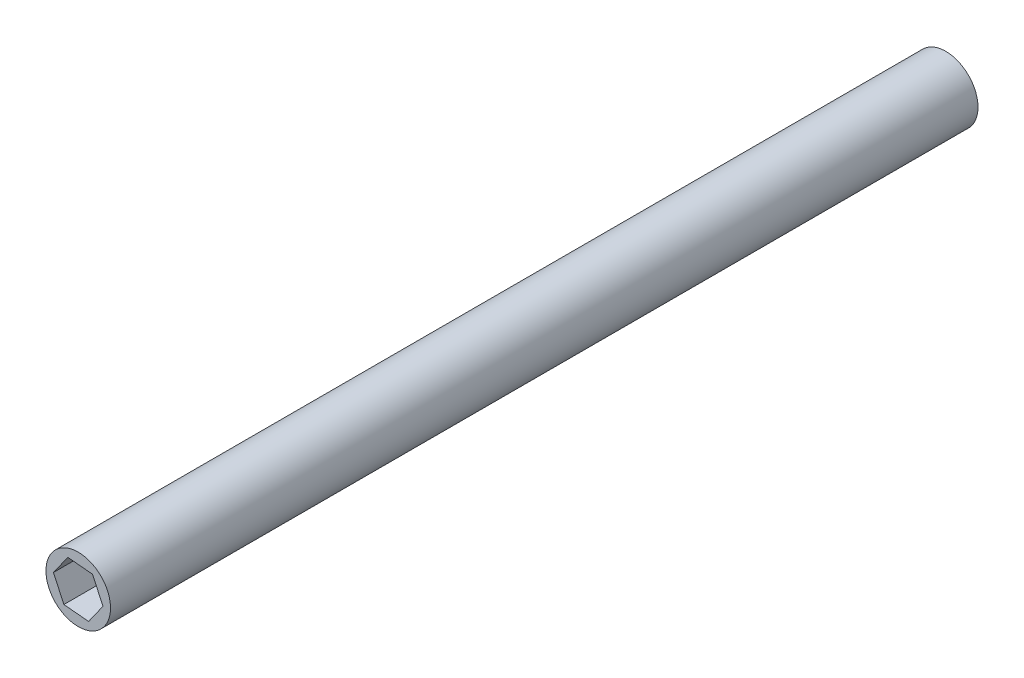
from build123d import *

# Parameters (mm, degrees)
IZIM1_R                         = 12
Y_KSEKLIK_EKSTR_ZYON1_DEPTH     = 300
Y_KSEKLIK_EKSTR_ZYON2_START     = -22.5
Y_KSEKLIK_EKSTR_ZYON2_OUTLINE_R = 12
Y_KSEKLIK_EKSTR_ZYON2_DEPTH     = 22.5


# Read off the part's stored shape, not the designer's step: Yükseklik-Ekstrüzyon2
with BuildPart() as part:
    # Çizim1 → Yükseklik-Ekstrüzyon1 (new body)
    with BuildSketch(Plane.XY):
        Circle(IZIM1_R)
        Polygon((9.198634805, -0.847614925), (5.33337346, 7.542443958), (-3.865261344, 8.390058884), (-9.198634805, 0.847614925), (-5.33337346, -7.542443958), (3.865261344, -8.390058884), align=None, mode=Mode.SUBTRACT)
    extrude(amount=Y_KSEKLIK_EKSTR_ZYON1_DEPTH)

    # Yükseklik-Ekstrüzyon2 outline → Yükseklik-Ekstrüzyon2 (add)
    with BuildSketch(Plane.XY.offset(Y_KSEKLIK_EKSTR_ZYON2_START)):
        Circle(Y_KSEKLIK_EKSTR_ZYON2_OUTLINE_R)
        with BuildLine():
            ThreePointArc((7.692208361, 1.457590549), (7.755311042, 1.36747058), (7.726836763, 1.261203123))
            Line((7.726836763, 1.261203123), (7.386733823, 0.855884222))
            ThreePointArc((7.386733823, 0.855884222), (7.407856389, 0.648103455), (7.423135474, 0.439811449))
            Line((7.423135474, 0.439811449), (7.828454374, 0.099708509))
            ThreePointArc((7.828454374, 0.099708509), (7.874949216, 0), (7.828454374, -0.099708509))
            Line((7.828454374, -0.099708509), (7.423135474, -0.439811449))
            ThreePointArc((7.423135474, -0.439811449), (7.407856389, -0.648103455), (7.386733823, -0.855884222))
            Line((7.386733823, -0.855884222), (7.726836763, -1.261203123))
            ThreePointArc((7.726836763, -1.261203123), (7.755311042, -1.36747058), (7.692208361, -1.457590549))
            Line((7.692208361, -1.457590549), (7.23398891, -1.722143673))
            ThreePointArc((7.23398891, -1.722143673), (7.182772421, -1.92461807), (7.125890003, -2.125574285))
            Line((7.125890003, -2.125574285), (7.390443126, -2.583793737))
            ThreePointArc((7.390443126, -2.583793737), (7.400031667, -2.69339126), (7.322238489, -2.771184438))
            Line((7.322238489, -2.771184438), (6.825041253, -2.952149432))
            ThreePointArc((6.825041253, -2.952149432), (6.739443548, -3.142654138), (6.648529621, -3.330679849))
            Line((6.648529621, -3.330679849), (6.829494615, -3.827877085))
            ThreePointArc((6.829494615, -3.827877085), (6.819906075, -3.937474608), (6.729786106, -4.000577289))
            Line((6.729786106, -4.000577289), (6.208718171, -4.092455625))
            ThreePointArc((6.208718171, -4.092455625), (6.091340093, -4.265202251), (5.96915703, -4.434584391))
            Line((5.96915703, -4.434584391), (6.061035366, -4.955652325))
            ThreePointArc((6.061035366, -4.955652325), (6.032561087, -5.061919783), (5.932852577, -5.108414624))
            Line((5.932852577, -5.108414624), (5.40374633, -5.108414624))
            ThreePointArc((5.40374633, -5.108414624), (5.258154352, -5.258154352), (5.108414624, -5.40374633))
            Line((5.108414624, -5.40374633), (5.108414624, -5.932852577))
            ThreePointArc((5.108414624, -5.932852577), (5.061919783, -6.032561087), (4.955652325, -6.061035366))
            Line((4.955652325, -6.061035366), (4.434584391, -5.96915703))
            ThreePointArc((4.434584391, -5.96915703), (4.265202251, -6.091340093), (4.092455625, -6.208718171))
            Line((4.092455625, -6.208718171), (4.000577289, -6.729786106))
            ThreePointArc((4.000577289, -6.729786106), (3.937474608, -6.819906075), (3.827877085, -6.829494615))
            Line((3.827877085, -6.829494615), (3.330679849, -6.648529621))
            ThreePointArc((3.330679849, -6.648529621), (3.142654138, -6.739443548), (2.952149432, -6.825041253))
            Line((2.952149432, -6.825041253), (2.771184438, -7.322238489))
            ThreePointArc((2.771184438, -7.322238489), (2.69339126, -7.400031667), (2.583793737, -7.390443126))
            Line((2.583793737, -7.390443126), (2.125574285, -7.125890003))
            ThreePointArc((2.125574285, -7.125890003), (1.92461807, -7.182772421), (1.722143673, -7.23398891))
            Line((1.722143673, -7.23398891), (1.457590549, -7.692208361))
            ThreePointArc((1.457590549, -7.692208361), (1.36747058, -7.755311042), (1.261203123, -7.726836763))
            Line((1.261203123, -7.726836763), (0.855884222, -7.386733823))
            ThreePointArc((0.855884222, -7.386733823), (0.648103455, -7.407856389), (0.439811449, -7.423135474))
            Line((0.439811449, -7.423135474), (0.099708509, -7.828454374))
            ThreePointArc((0.099708509, -7.828454374), (0, -7.874949216), (-0.099708509, -7.828454374))
            Line((-0.099708509, -7.828454374), (-0.439811449, -7.423135474))
            ThreePointArc((-0.439811449, -7.423135474), (-0.648103455, -7.407856389), (-0.855884222, -7.386733823))
            Line((-0.855884222, -7.386733823), (-1.261203123, -7.726836763))
            ThreePointArc((-1.261203123, -7.726836763), (-1.36747058, -7.755311042), (-1.457590549, -7.692208361))
            Line((-1.457590549, -7.692208361), (-1.722143673, -7.23398891))
            ThreePointArc((-1.722143673, -7.23398891), (-1.92461807, -7.182772421), (-2.125574285, -7.125890003))
            Line((-2.125574285, -7.125890003), (-2.583793737, -7.390443126))
            ThreePointArc((-2.583793737, -7.390443126), (-2.69339126, -7.400031667), (-2.771184438, -7.322238489))
            Line((-2.771184438, -7.322238489), (-2.952149432, -6.825041253))
            ThreePointArc((-2.952149432, -6.825041253), (-3.142654138, -6.739443548), (-3.330679849, -6.648529621))
            Line((-3.330679849, -6.648529621), (-3.827877085, -6.829494615))
            ThreePointArc((-3.827877085, -6.829494615), (-3.937474608, -6.819906075), (-4.000577289, -6.729786106))
            Line((-4.000577289, -6.729786106), (-4.092455625, -6.208718171))
            ThreePointArc((-4.092455625, -6.208718171), (-4.265202251, -6.091340093), (-4.434584391, -5.96915703))
            Line((-4.434584391, -5.96915703), (-4.955652325, -6.061035366))
            ThreePointArc((-4.955652325, -6.061035366), (-5.061919783, -6.032561087), (-5.108414624, -5.932852577))
            Line((-5.108414624, -5.932852577), (-5.108414624, -5.40374633))
            ThreePointArc((-5.108414624, -5.40374633), (-5.258154352, -5.258154352), (-5.40374633, -5.108414624))
            Line((-5.40374633, -5.108414624), (-5.932852577, -5.108414624))
            ThreePointArc((-5.932852577, -5.108414624), (-6.032561087, -5.061919783), (-6.061035366, -4.955652325))
            Line((-6.061035366, -4.955652325), (-5.96915703, -4.434584391))
            ThreePointArc((-5.96915703, -4.434584391), (-6.091340093, -4.265202251), (-6.208718171, -4.092455625))
            Line((-6.208718171, -4.092455625), (-6.729786106, -4.000577289))
            ThreePointArc((-6.729786106, -4.000577289), (-6.819906075, -3.937474608), (-6.829494615, -3.827877085))
            Line((-6.829494615, -3.827877085), (-6.648529621, -3.330679849))
            ThreePointArc((-6.648529621, -3.330679849), (-6.739443548, -3.142654138), (-6.825041253, -2.952149432))
            Line((-6.825041253, -2.952149432), (-7.322238489, -2.771184438))
            ThreePointArc((-7.322238489, -2.771184438), (-7.400031667, -2.69339126), (-7.390443126, -2.583793737))
            Line((-7.390443126, -2.583793737), (-7.125890003, -2.125574285))
            ThreePointArc((-7.125890003, -2.125574285), (-7.182772421, -1.92461807), (-7.23398891, -1.722143673))
            Line((-7.23398891, -1.722143673), (-7.692208361, -1.457590549))
            ThreePointArc((-7.692208361, -1.457590549), (-7.755311042, -1.36747058), (-7.726836763, -1.261203123))
            Line((-7.726836763, -1.261203123), (-7.386733823, -0.855884222))
            ThreePointArc((-7.386733823, -0.855884222), (-7.407856389, -0.648103455), (-7.423135474, -0.439811449))
            Line((-7.423135474, -0.439811449), (-7.828454374, -0.099708509))
            ThreePointArc((-7.828454374, -0.099708509), (-7.874949216, 0), (-7.828454374, 0.099708509))
            Line((-7.828454374, 0.099708509), (-7.423135474, 0.439811449))
            ThreePointArc((-7.423135474, 0.439811449), (-7.407856389, 0.648103455), (-7.386733823, 0.855884222))
            Line((-7.386733823, 0.855884222), (-7.726836763, 1.261203123))
            ThreePointArc((-7.726836763, 1.261203123), (-7.755311042, 1.36747058), (-7.692208361, 1.457590549))
            Line((-7.692208361, 1.457590549), (-7.23398891, 1.722143673))
            ThreePointArc((-7.23398891, 1.722143673), (-7.182772421, 1.92461807), (-7.125890003, 2.125574285))
            Line((-7.125890003, 2.125574285), (-7.390443126, 2.583793737))
            ThreePointArc((-7.390443126, 2.583793737), (-7.400031667, 2.69339126), (-7.322238489, 2.771184438))
            Line((-7.322238489, 2.771184438), (-6.825041253, 2.952149432))
            ThreePointArc((-6.825041253, 2.952149432), (-6.739443548, 3.142654138), (-6.648529621, 3.330679849))
            Line((-6.648529621, 3.330679849), (-6.829494615, 3.827877085))
            ThreePointArc((-6.829494615, 3.827877085), (-6.819906075, 3.937474608), (-6.729786106, 4.000577289))
            Line((-6.729786106, 4.000577289), (-6.208718171, 4.092455625))
            ThreePointArc((-6.208718171, 4.092455625), (-6.091340093, 4.265202251), (-5.96915703, 4.434584391))
            Line((-5.96915703, 4.434584391), (-6.061035366, 4.955652325))
            ThreePointArc((-6.061035366, 4.955652325), (-6.032561087, 5.061919783), (-5.932852577, 5.108414624))
            Line((-5.932852577, 5.108414624), (-5.40374633, 5.108414624))
            ThreePointArc((-5.40374633, 5.108414624), (-5.258154352, 5.258154352), (-5.108414624, 5.40374633))
            Line((-5.108414624, 5.40374633), (-5.108414624, 5.932852577))
            ThreePointArc((-5.108414624, 5.932852577), (-5.061919783, 6.032561087), (-4.955652325, 6.061035366))
            Line((-4.955652325, 6.061035366), (-4.434584391, 5.96915703))
            ThreePointArc((-4.434584391, 5.96915703), (-4.265202251, 6.091340093), (-4.092455625, 6.208718171))
            Line((-4.092455625, 6.208718171), (-4.000577289, 6.729786106))
            ThreePointArc((-4.000577289, 6.729786106), (-3.937474608, 6.819906075), (-3.827877085, 6.829494615))
            Line((-3.827877085, 6.829494615), (-3.330679849, 6.648529621))
            ThreePointArc((-3.330679849, 6.648529621), (-3.142654138, 6.739443548), (-2.952149432, 6.825041253))
            Line((-2.952149432, 6.825041253), (-2.771184438, 7.322238489))
            ThreePointArc((-2.771184438, 7.322238489), (-2.69339126, 7.400031667), (-2.583793737, 7.390443126))
            Line((-2.583793737, 7.390443126), (-2.125574285, 7.125890003))
            ThreePointArc((-2.125574285, 7.125890003), (-1.92461807, 7.182772421), (-1.722143673, 7.23398891))
            Line((-1.722143673, 7.23398891), (-1.457590549, 7.692208361))
            ThreePointArc((-1.457590549, 7.692208361), (-1.36747058, 7.755311042), (-1.261203123, 7.726836763))
            Line((-1.261203123, 7.726836763), (-0.855884222, 7.386733823))
            Line((-0.855884222, 7.386733823), (0.855884222, 7.386733823))
            Line((0.855884222, 7.386733823), (1.261203123, 7.726836763))
            ThreePointArc((1.261203123, 7.726836763), (1.36747058, 7.755311042), (1.457590549, 7.692208361))
            Line((1.457590549, 7.692208361), (1.722143673, 7.23398891))
            ThreePointArc((1.722143673, 7.23398891), (1.92461807, 7.182772421), (2.125574285, 7.125890003))
            Line((2.125574285, 7.125890003), (2.583793737, 7.390443126))
            ThreePointArc((2.583793737, 7.390443126), (2.69339126, 7.400031667), (2.771184438, 7.322238489))
            Line((2.771184438, 7.322238489), (2.952149432, 6.825041253))
            ThreePointArc((2.952149432, 6.825041253), (3.142654138, 6.739443548), (3.330679849, 6.648529621))
            Line((3.330679849, 6.648529621), (3.827877085, 6.829494615))
            ThreePointArc((3.827877085, 6.829494615), (3.937474608, 6.819906075), (4.000577289, 6.729786106))
            Line((4.000577289, 6.729786106), (4.092455625, 6.208718171))
            ThreePointArc((4.092455625, 6.208718171), (4.265202251, 6.091340093), (4.434584391, 5.96915703))
            Line((4.434584391, 5.96915703), (4.955652325, 6.061035366))
            ThreePointArc((4.955652325, 6.061035366), (5.061919783, 6.032561087), (5.108414624, 5.932852577))
            Line((5.108414624, 5.932852577), (5.108414624, 5.40374633))
            ThreePointArc((5.108414624, 5.40374633), (5.258154352, 5.258154352), (5.40374633, 5.108414624))
            Line((5.40374633, 5.108414624), (5.932852577, 5.108414624))
            ThreePointArc((5.932852577, 5.108414624), (6.032561087, 5.061919783), (6.061035366, 4.955652325))
            Line((6.061035366, 4.955652325), (5.96915703, 4.434584391))
            ThreePointArc((5.96915703, 4.434584391), (6.091340093, 4.265202251), (6.208718171, 4.092455625))
            Line((6.208718171, 4.092455625), (6.729786106, 4.000577289))
            ThreePointArc((6.729786106, 4.000577289), (6.819906075, 3.937474608), (6.829494615, 3.827877085))
            Line((6.829494615, 3.827877085), (6.648529621, 3.330679849))
            ThreePointArc((6.648529621, 3.330679849), (6.739443548, 3.142654138), (6.825041253, 2.952149432))
            Line((6.825041253, 2.952149432), (7.322238489, 2.771184438))
            ThreePointArc((7.322238489, 2.771184438), (7.400031667, 2.69339126), (7.390443126, 2.583793737))
            Line((7.390443126, 2.583793737), (7.125890003, 2.125574285))
            ThreePointArc((7.125890003, 2.125574285), (7.182772421, 1.92461807), (7.23398891, 1.722143673))
            Line((7.23398891, 1.722143673), (7.692208361, 1.457590549))
        make_face(mode=Mode.SUBTRACT)
    extrude(amount=Y_KSEKLIK_EKSTR_ZYON2_DEPTH)


solid = part.part
